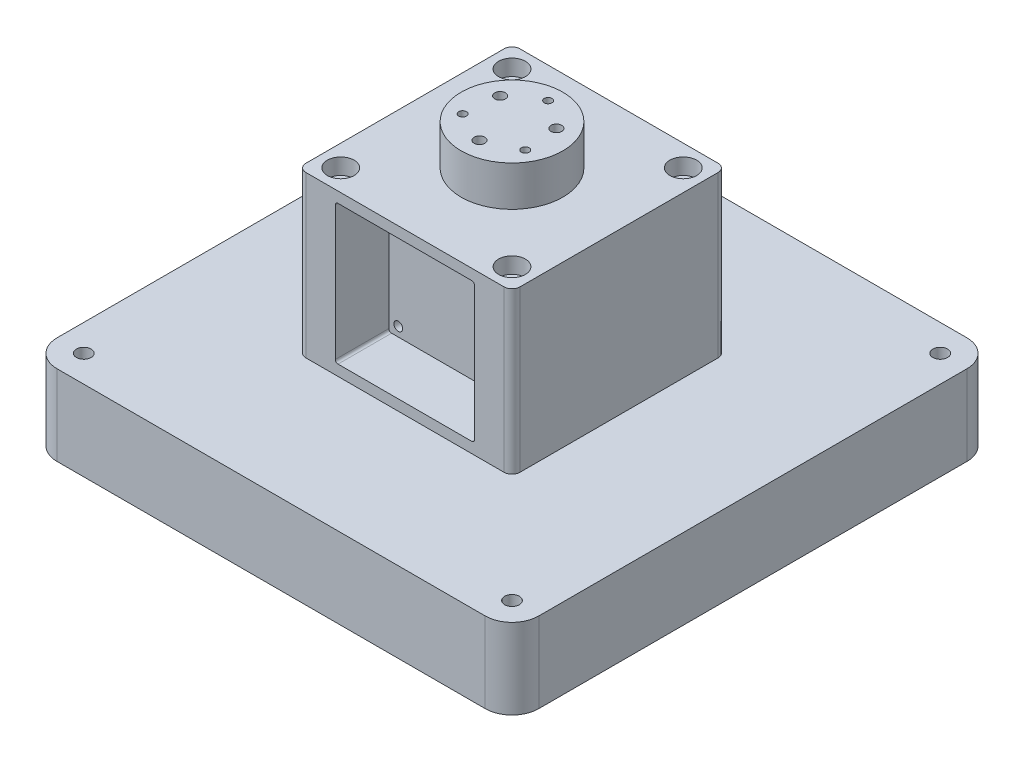
from build123d import *

# Parameters (mm, degrees)
SKETCH_1_R            = 2.75
EXTRUDE_1_DEPTH       = 30
SKETCH_2_W            = 80
SKETCH_2_H            = 80
EXTRUDE_2_DEPTH       = 60
EXTRUDE_3_OUTLINE_R   = 19
EXTRUDE_3_OUTLINE_R_2 = 1.45
EXTRUDE_3_OUTLINE_R_3 = 2
EXTRUDE_3_DEPTH       = 15
SKETCH_4_R            = 1.45
SKETCH_4_R_2          = 2
CUT_EXTRUDE_1_DEPTH   = 89
FILLET_1_R            = 3
SKETCH_6_W            = 52
SKETCH_6_H            = 52
CUT_EXTRUDE_3_DEPTH   = 20
CUT_EXTRUDE_START     = -30
SKETCH_5_R            = 3.75
SKETCH_5_R_2          = 3
CUT_EXTRUDE_4_DEPTH   = 20
SKETCH_7_R            = 2.65
CUT_EXTRUDE_5_DEPTH   = 80.5
CUT_EXTRUDE_START_2   = -60
SKETCH_8_R            = 5
CUT_EXTRUDE_7_DEPTH   = 6
FILLET_3_R            = 1
SKETCH_9_R            = 1.65
CUT_EXTRUDE_8_DEPTH   = 60
SKETCH_10_R           = 3
CUT_EXTRUDE_9_DEPTH   = 4
SKETCH_11_R           = 2.65
CUT_EXTRUDE_10_DEPTH  = 30
SKETCH_12_R           = 5
CUT_EXTRUDE_11_DEPTH  = 5


# Read off the part's stored shape, not the designer's step: 凸台-拉伸3
with BuildPart() as part:
    # 草图1 → 凸台-拉伸1 (new body)
    with BuildSketch(Plane(origin=(0, 0, 0), x_dir=(1, 0, 0), z_dir=(0, 1, 0))):
        with BuildLine():
            Line((-80, 90), (80, 90))
            ThreePointArc((80, 90), (87.071067812, 87.071067812), (90, 80))
            Line((90, 80), (90, -80))
            ThreePointArc((90, -80), (87.071067812, -87.071067812), (80, -90))
            Line((80, -90), (-80, -90))
            ThreePointArc((-80, -90), (-87.071067812, -87.071067812), (-90, -80))
            Line((-90, -80), (-90, 80))
            ThreePointArc((-90, 80), (-87.071067812, 87.071067812), (-80, 90))
        make_face()
        with Locations(Location((-80, 80, 0), (0, 0, 270))):
            Circle(SKETCH_1_R, mode=Mode.SUBTRACT)
        with Locations(Location((-80, -80, 0), (0, 0, 270))):
            Circle(SKETCH_1_R, mode=Mode.SUBTRACT)
        with Locations(Location((80, 80, 0), (0, 0, 270))):
            Circle(SKETCH_1_R, mode=Mode.SUBTRACT)
        with Locations(Location((80, -80, 0), (0, 0, 270))):
            Circle(SKETCH_1_R, mode=Mode.SUBTRACT)
    extrude(amount=EXTRUDE_1_DEPTH)


with BuildPart() as body_2:
    # 草图2 → 凸台-拉伸2 (new body)
    with BuildSketch(Plane(origin=(0, 30, 0), x_dir=(1, 0, 0), z_dir=(0, 1, 0))):
        Rectangle(SKETCH_2_W, SKETCH_2_H)
    extrude(amount=EXTRUDE_2_DEPTH)

    # 凸台-拉伸3 outline → 凸台-拉伸3 (add)
    with BuildSketch(Plane(origin=(0, 90, 0), x_dir=(1, 0, 0), z_dir=(0, 1, 0))):
        Circle(EXTRUDE_3_OUTLINE_R)
        with Locations((-11.691342951, -6.75)):
            Circle(EXTRUDE_3_OUTLINE_R_2, mode=Mode.SUBTRACT)
        with Locations((0, -12.15)):
            Circle(EXTRUDE_3_OUTLINE_R_3, mode=Mode.SUBTRACT)
        with Locations((11.691342951, -6.75)):
            Circle(EXTRUDE_3_OUTLINE_R_2, mode=Mode.SUBTRACT)
        with Locations((-10.522208656, 6.075)):
            Circle(EXTRUDE_3_OUTLINE_R_3, mode=Mode.SUBTRACT)
        with Locations((10.522208656, 6.075)):
            Circle(EXTRUDE_3_OUTLINE_R_3, mode=Mode.SUBTRACT)
        with Locations((0, 13.5)):
            Circle(EXTRUDE_3_OUTLINE_R_2, mode=Mode.SUBTRACT)
    extrude(amount=EXTRUDE_3_DEPTH)


with BuildPart() as cut_extrude_1_tool:
    # 草图4 → 切除-拉伸1 (new body)
    with BuildSketch(Plane(origin=(0, 105, 0), x_dir=(1, 0, 0), z_dir=(0, 1, 0))):
        with Locations(Location((-11.691342951, -6.75, 0), (0, 0, 90))):
            Circle(SKETCH_4_R)
        with Locations(Location((0, -12.15, 0), (0, 0, 90))):
            Circle(SKETCH_4_R_2)
        with Locations(Location((11.691342951, -6.75, 0), (0, 0, 90))):
            Circle(SKETCH_4_R)
        with Locations(Location((10.522208656, 6.075, 0), (0, 0, 90))):
            Circle(SKETCH_4_R_2)
        with Locations(Location((-10.522208656, 6.075, 0), (0, 0, 90))):
            Circle(SKETCH_4_R_2)
        with Locations(Location((0, 13.5, 0), (0, 0, 90))):
            Circle(SKETCH_4_R)
    extrude(amount=-CUT_EXTRUDE_1_DEPTH)


with BuildPart() as part_1:
    add(part.part)

    # 切除-拉伸1: cut by cut_extrude_1_tool
    add(cut_extrude_1_tool.part, mode=Mode.SUBTRACT)

    # 草图11 → 切除-拉伸10 (cut)
    with BuildSketch(Plane.XZ):
        with Locations(Location((32, 32, 0), (0, 0, 90))):
            Circle(SKETCH_11_R)
        with Locations(Location((32, -32, 0), (0, 0, 90))):
            Circle(SKETCH_11_R)
        with Locations(Location((-32, -32, 0), (0, 0, 90))):
            Circle(SKETCH_11_R)
        with Locations(Location((-32, 32, 0), (0, 0, 90))):
            Circle(SKETCH_11_R)
    extrude(amount=-CUT_EXTRUDE_10_DEPTH, mode=Mode.SUBTRACT)

    # 草图12 → 切除-拉伸11 (cut)
    with BuildSketch(Plane.XZ):
        with Locations(Location((32, 32, 0), (0, 0, 270))):
            Circle(SKETCH_12_R)
        with Locations(Location((32, -32, 0), (0, 0, 270))):
            Circle(SKETCH_12_R)
        with Locations(Location((-32, -32, 0), (0, 0, 270))):
            Circle(SKETCH_12_R)
        with Locations(Location((-32, 32, 0), (0, 0, 270))):
            Circle(SKETCH_12_R)
    extrude(amount=-CUT_EXTRUDE_11_DEPTH, mode=Mode.SUBTRACT)


with BuildPart() as body_2_1:
    add(body_2.part)

    # 切除-拉伸1: cut by cut_extrude_1_tool
    add(cut_extrude_1_tool.part, mode=Mode.SUBTRACT)

    # 圆角1
    fillet_1_edges = [body_2_1.edges().sort_by_distance(p)[0] for p in [
        (40, 60, 40),
        (-40, 60, 40),
        (-40, 60, -40),
        (40, 60, -40),
    ]]
    fillet(fillet_1_edges, radius=FILLET_1_R)

    # 草图6 → 切除-拉伸3 (cut)
    with BuildSketch(Plane.XY.offset(40)):
        with Locations((0, 60)):
            Rectangle(SKETCH_6_W, SKETCH_6_H)
    extrude(amount=-CUT_EXTRUDE_3_DEPTH, mode=Mode.SUBTRACT)

    # 草图5 → 切除-拉伸4 (cut)
    with BuildSketch(Plane.XZ.offset(CUT_EXTRUDE_START)):
        with Locations(Location((0, 12.15, 0), (0, 0, 270))):
            Circle(SKETCH_5_R)
        with Locations(Location((10.522208656, -6.075, 0), (0, 0, 270))):
            Circle(SKETCH_5_R)
        with Locations(Location((-10.522208656, -6.075, 0), (0, 0, 270))):
            Circle(SKETCH_5_R)
        with Locations(Location((-11.691342951, 6.75, 0), (0, 0, 270))):
            Circle(SKETCH_5_R_2)
        with Locations(Location((11.691342951, 6.75, 0), (0, 0, 270))):
            Circle(SKETCH_5_R_2)
        with Locations(Location((0, -13.5, 0), (0, 0, 270))):
            Circle(SKETCH_5_R_2)
    extrude(amount=-CUT_EXTRUDE_4_DEPTH, mode=Mode.SUBTRACT)

    # 草图7 → 切除-拉伸5 (cut)
    with BuildSketch(Plane(origin=(0, 90, 0), x_dir=(1, 0, 0), z_dir=(0, 1, 0))):
        with Locations(Location((32, 32, 0), (0, 0, 270))):
            Circle(SKETCH_7_R)
        with Locations(Location((-32, 32, 0), (0, 0, 270))):
            Circle(SKETCH_7_R)
        with Locations(Location((-32, -32, 0), (0, 0, 270))):
            Circle(SKETCH_7_R)
        with Locations(Location((32, -32, 0), (0, 0, 270))):
            Circle(SKETCH_7_R)
    extrude(amount=-CUT_EXTRUDE_5_DEPTH, mode=Mode.SUBTRACT)

    # 草图8 → 切除-拉伸7 (cut)
    with BuildSketch(Plane.XZ.offset(-30).offset(CUT_EXTRUDE_START_2)):
        with Locations(Location((32, 32, 0), (0, 0, 270))):
            Circle(SKETCH_8_R)
        with Locations(Location((-32, 32, 0), (0, 0, 270))):
            Circle(SKETCH_8_R)
        with Locations(Location((-32, -32, 0), (0, 0, 270))):
            Circle(SKETCH_8_R)
        with Locations(Location((32, -32, 0), (0, 0, 270))):
            Circle(SKETCH_8_R)
    extrude(amount=CUT_EXTRUDE_7_DEPTH, mode=Mode.SUBTRACT)

    # 圆角3
    fillet_3_edges = [body_2_1.edges().sort_by_distance(p)[0] for p in [
        (-26, 34, 30),
        (-26, 86, 30),
        (26, 86, 30),
        (26, 34, 30),
    ]]
    fillet(fillet_3_edges, radius=FILLET_3_R)

    # 草图9 → 切除-拉伸8 (cut)
    with BuildSketch(Plane.XY.offset(20)):
        with Locations((-22.5, 82.5)):
            Circle(SKETCH_9_R)
        with Locations((22.5, 82.5)):
            Circle(SKETCH_9_R)
        with Locations((22.5, 37.5)):
            Circle(SKETCH_9_R)
        with Locations((-22.5, 37.5)):
            Circle(SKETCH_9_R)
    extrude(amount=-CUT_EXTRUDE_8_DEPTH, mode=Mode.SUBTRACT)

    # 草图10 → 切除-拉伸9 (cut)
    with BuildSketch(Plane(origin=(0, 0, -40), x_dir=(-1, 0, 0), z_dir=(0, 0, -1))):
        with Locations((-22.5, 82.5)):
            Circle(SKETCH_10_R)
        with Locations((22.5, 82.5)):
            Circle(SKETCH_10_R)
        with Locations((22.5, 37.5)):
            Circle(SKETCH_10_R)
        with Locations((-22.5, 37.5)):
            Circle(SKETCH_10_R)
    extrude(amount=-CUT_EXTRUDE_9_DEPTH, mode=Mode.SUBTRACT)


solid = Compound([part_1.part, body_2_1.part])
